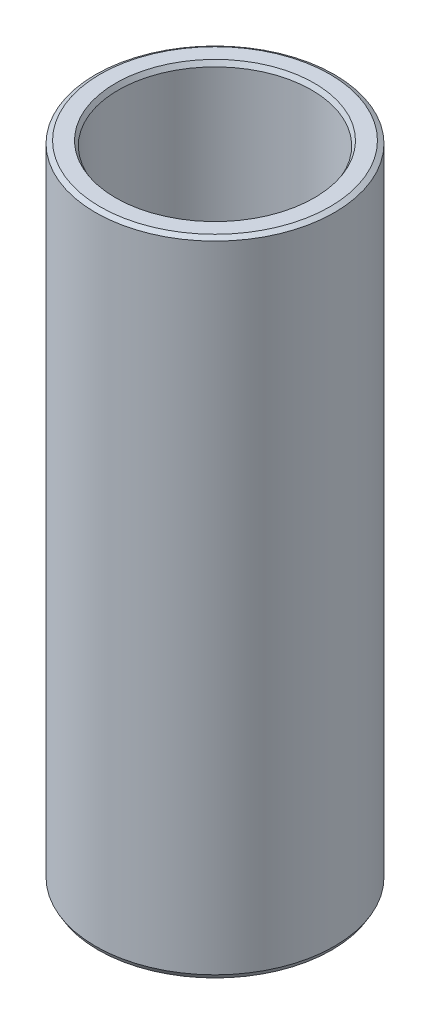
from build123d import *
from OCP.BRepFilletAPI import BRepFilletAPI_MakeChamfer

# Parameters (mm, degrees)
SKETCH1_R           = 52.5
BOSS_EXTRUDE1_DEPTH = 282.368057774
SKETCH2_R           = 42.484819805
CUT_EXTRUDE1_DEPTH  = 292.96612826
CHAMFER1_SIZE       = 1.170137184
CHAMFER1_SIZE2      = 2.026737054


with BuildPart() as part:
    # Sketch1 → Boss-Extrude1 (new body)
    with BuildSketch(Plane(origin=(0, 0, 0), x_dir=(1, 0, 0), z_dir=(0, 1, 0))):
        Circle(SKETCH1_R)
    extrude(amount=BOSS_EXTRUDE1_DEPTH)

    # Sketch2 → Cut-Extrude1 (cut, through all)
    with BuildSketch(Plane(origin=(0, 0, 0), x_dir=(1, 0, 0), z_dir=(0, 1, 0))):
        Circle(SKETCH2_R)
    extrude(amount=CUT_EXTRUDE1_DEPTH, mode=Mode.SUBTRACT)

    # Chamfer1: one chamfer whose edges measure the first distance from different faces: ONE call of the kernel's chamfer builder (chamfer() names one face for all edges)
    chamfer1_edges_1 = [part.edges().sort_by_distance(p)[0] for p in [
        (-42.484819805, 282.368057774, 0),
    ]]
    chamfer1_side_1 = [part.faces().sort_by_distance(p)[0] for p in [
        (-51.01507576, 282.368057774, 0),
    ]]
    chamfer1_edges_2 = [part.edges().sort_by_distance(p)[0] for p in [
        (-42.484819805, 0, 0),
    ]]
    chamfer1_side_2 = [part.faces().sort_by_distance(p)[0] for p in [
        (-42.484819805, 141.184028887, 0),
    ]]
    chamfer1_edges_3 = [part.edges().sort_by_distance(p)[0] for p in [
        (-52.5, 0, 0),
    ]]
    chamfer1_side_3 = [part.faces().sort_by_distance(p)[0] for p in [
        (-51.01507576, 0, 0),
    ]]
    chamfer1_edges_4 = [part.edges().sort_by_distance(p)[0] for p in [
        (-52.5, 282.368057774, 0),
    ]]
    chamfer1_side_4 = [part.faces().sort_by_distance(p)[0] for p in [
        (-52.5, 141.184028887, 0),
    ]]
    chamfer1 = BRepFilletAPI_MakeChamfer(part.part.solid().wrapped)
    for e in chamfer1_edges_1:
        chamfer1.Add(CHAMFER1_SIZE, CHAMFER1_SIZE2, e.wrapped, chamfer1_side_1[0].wrapped)  # the first distance lies on this face
    for e in chamfer1_edges_2:
        chamfer1.Add(CHAMFER1_SIZE, CHAMFER1_SIZE2, e.wrapped, chamfer1_side_2[0].wrapped)  # the first distance lies on this face
    for e in chamfer1_edges_3:
        chamfer1.Add(CHAMFER1_SIZE, CHAMFER1_SIZE2, e.wrapped, chamfer1_side_3[0].wrapped)  # the first distance lies on this face
    for e in chamfer1_edges_4:
        chamfer1.Add(CHAMFER1_SIZE, CHAMFER1_SIZE2, e.wrapped, chamfer1_side_4[0].wrapped)  # the first distance lies on this face
    add(Compound.cast(chamfer1.Shape()), mode=Mode.REPLACE)


solid = part.part
